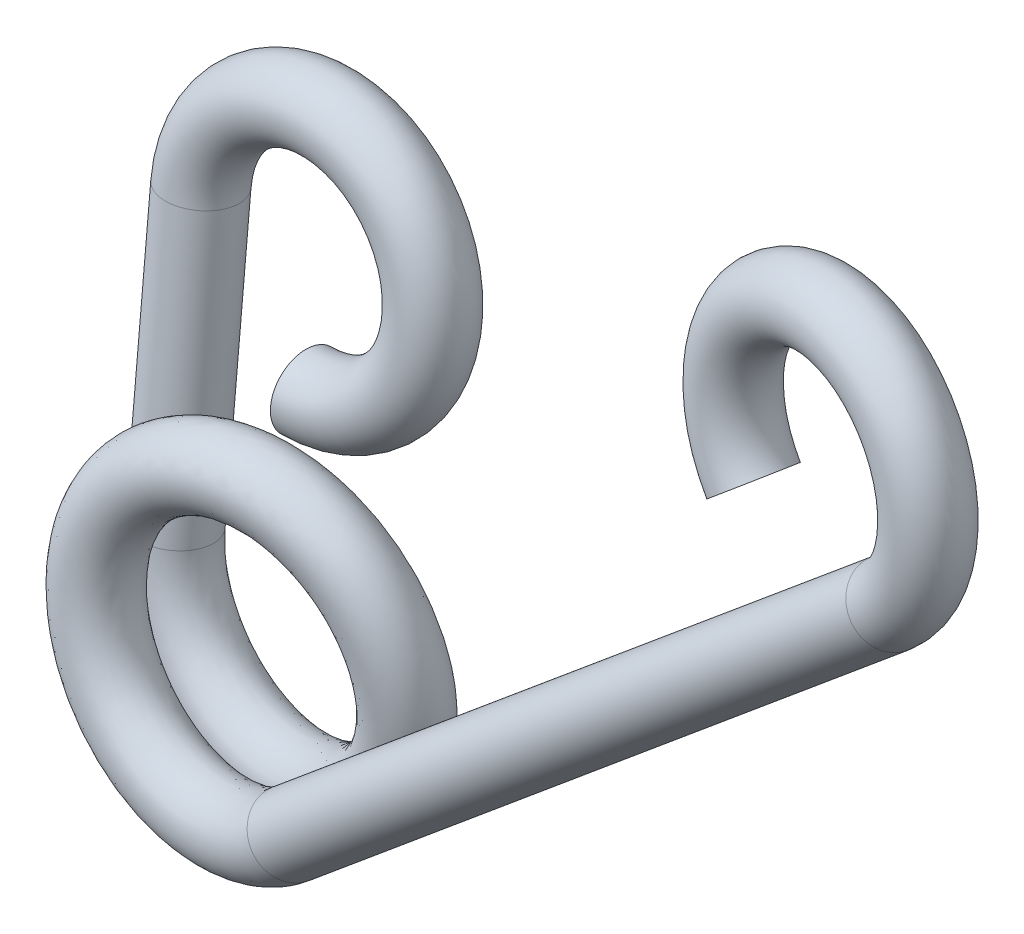
from build123d import *

# Parameters (mm, degrees)
SWEEP1_PITCH        = 1.691093574
SWEEP1_HEIGHT       = 2.304
SWEEP1_RADIUS       = 2.925
SWEEP1_START_ANGLE  = -180
SWEEP1_PROFILE_R    = 0.7685
SKETCH7_R           = 0.7685
BOSS_EXTRUDE1_DEPTH = 6.112
SKETCH8_R           = 0.7685
BOSS_EXTRUDE2_DEPTH = 19.442
SKETCH11_R          = 0.7685
SKETCH13_R          = 0.7685


with BuildPart() as part:
    # Sweep1: sweep along a helix
    with BuildLine() as sweep1_path:
        add(Helix(SWEEP1_PITCH, SWEEP1_HEIGHT, SWEEP1_RADIUS, center=(0, 0, 0), direction=(0, 0, 1), mode=Mode.PRIVATE).rotate(Axis((0, 0, 0), (0, 0, 1)), SWEEP1_START_ANGLE))
    # Sweep1 profile (on start of the path) → Sweep1 (sweep)
    with BuildSketch(Plane(origin=(-2.925, 0, 0), x_dir=(0, -0.0916286058923694, -0.9957932509222087), z_dir=(5.37769585920008e-15, -0.9957932509222087, 0.0916286058923694))):
        Circle(SWEEP1_PROFILE_R)
    sweep(path=sweep1_path.line, is_frenet=True)

    # Sketch7 → Boss-Extrude1 (add)
    with BuildSketch(Plane(origin=(0, 0, 0), x_dir=(1, 0, 0), z_dir=(-6.564467280906748e-15, 0.9957932509222046, -0.09162860589241555))):
        with Locations(Location((-2.925, 0, 0), (0, 0, 90))):
            Circle(SKETCH7_R)
    extrude(amount=BOSS_EXTRUDE1_DEPTH)


with BuildPart() as boss_extrude2_tool:
    # Sketch8 → Boss-Extrude2 (new body)
    with BuildSketch(Plane(origin=(0.159938056, 0.136479, 0.019346658), x_dir=(0.1474691482501653, -0.03268816646451709, -0.9885263446603529), z_dir=(0.7574900772095401, 0.6463845461575468, 0.09162860589241553))):
        with Locations(Location((-1.925160413, -3.180364199, 0), (0, 0, 6.926156226))):
            Circle(SKETCH8_R)
    extrude(amount=BOSS_EXTRUDE2_DEPTH)


with BuildPart() as part_1:
    add(part.part)


with BuildPart() as part_2:
    # Boss-Extrude2: joined with boss_extrude2_tool
    add(part_1.part.fuse(boss_extrude2_tool.part, tol=0.00001))

    # Sweep2: sweep along a path in Sketch10
    with BuildLine(Plane(origin=(0, 0, 0), x_dir=(1, 0, 0), z_dir=(0, 0.09162860589241555, 0.9957932509222045))) as sweep2_path:
        ThreePointArc((-2.925, 6.112), (1.342766953, 7.879766953), (-0.425, 3.612))
    # Sketch11 → Sweep2 (sweep)
    with BuildSketch(Plane(origin=(0, 6.08628835, -0.560034039), x_dir=(1, 0, 0), z_dir=(-6.5644672809067495e-15, 0.9957932509222046, -0.09162860589241555))):
        with Locations((-2.925, 0)):
            Circle(SKETCH11_R)
    sweep(path=sweep2_path.line)

    # Sweep3: sweep along a path in Sketch12
    with BuildLine(Plane(origin=(-0.283901766, 0.062929964, 1.903071786), x_dir=(-0.9890657559861645, -0.0035253546206446794, -0.14743304314269404), z_dir=(0.14746914825016533, -0.03268816646451704, -0.988526344660353))) as sweep3_path:
        ThreePointArc((-17.08283018, 10.224364256), (-15.686568725, 14.627691261), (-13.560252283, 10.526762933))
    # Sketch13 → Sweep3 (sweep)
    with BuildSketch(Plane(origin=(14.887060137, 12.703487346, 1.800790013), x_dir=(0.14746914825016522, -0.032688166464517, -0.988526344660353), z_dir=(0.75749007720954, 0.6463845461575467, 0.09162860589241552))):
        with Locations((-1.925160413, -3.180364199)):
            Circle(SKETCH13_R)
    sweep(path=sweep3_path.line)


solid = part_2.part
